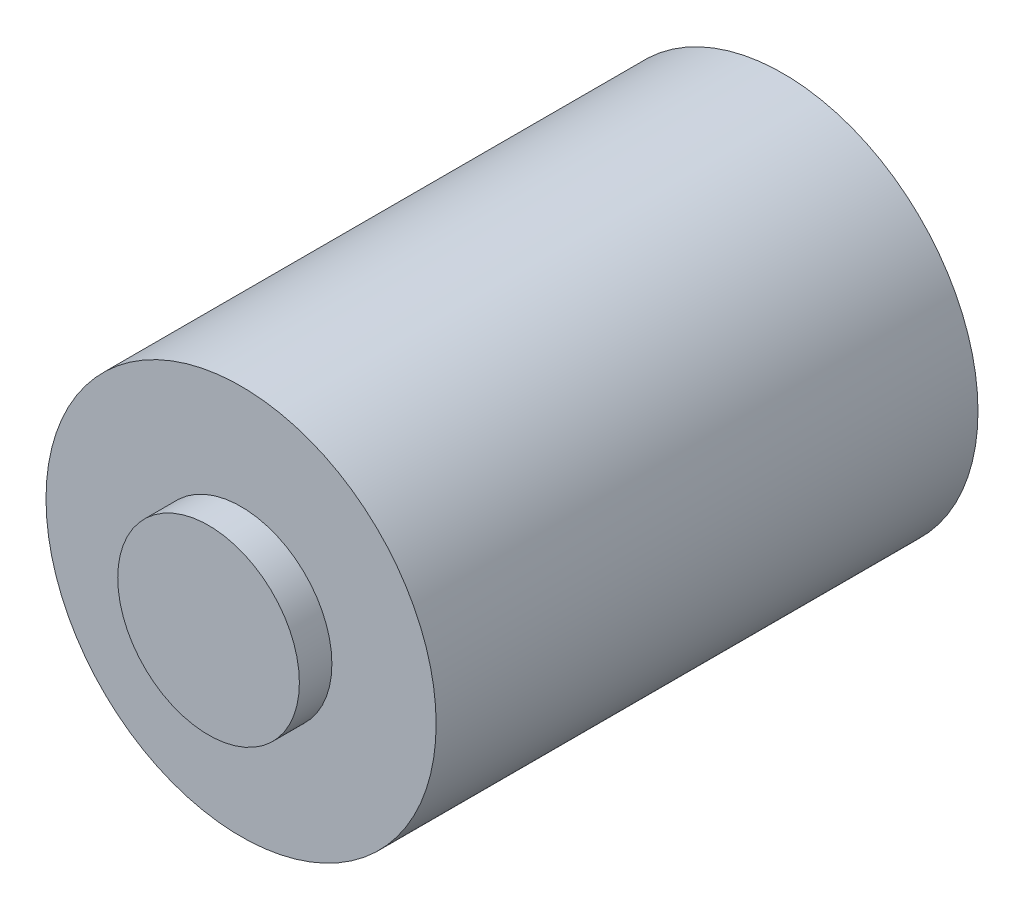
from build123d import *

# Parameters (mm, degrees)
SKETCH1_R           = 18
BOSS_EXTRUDE1_DEPTH = 50
SKETCH2_R           = 8.380776787
BOSS_EXTRUDE2_DEPTH = 3


with BuildPart() as part:
    # Sketch1 → Boss-Extrude1 (new body)
    with BuildSketch(Plane.XY):
        Circle(SKETCH1_R)
    extrude(amount=BOSS_EXTRUDE1_DEPTH)

    # Sketch2 → Boss-Extrude2 (add)
    with BuildSketch(Plane.XY.offset(50)):
        Circle(SKETCH2_R)
    extrude(amount=BOSS_EXTRUDE2_DEPTH)


solid = part.part
